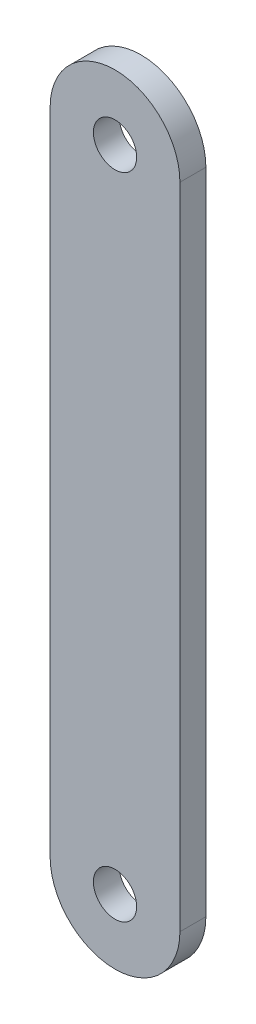
from build123d import *

# Parameters (mm, degrees)
SKETCH1_R           = 2.5
BOSS_EXTRUDE1_DEPTH = 3


with BuildPart() as part:
    # Sketch1 → Boss-Extrude1 (new body)
    with BuildSketch(Plane.XY):
        with BuildLine():
            Line((185.825363728, 60.532913208), (185.825363728, 135.532913208))
            ThreePointArc((185.825363728, 135.532913208), (193.325363728, 143.032913208), (200.825363728, 135.532913208))
            Line((200.825363728, 135.532913208), (200.825363728, 60.532913208))
            ThreePointArc((200.825363728, 60.532913208), (193.325363728, 53.032913208), (185.825363728, 60.532913208))
        make_face()
        with Locations((193.325363728, 60.532913208)):
            Circle(SKETCH1_R, mode=Mode.SUBTRACT)
        with Locations((193.325363728, 135.532913208)):
            Circle(SKETCH1_R, mode=Mode.SUBTRACT)
    extrude(amount=BOSS_EXTRUDE1_DEPTH)


solid = part.part
